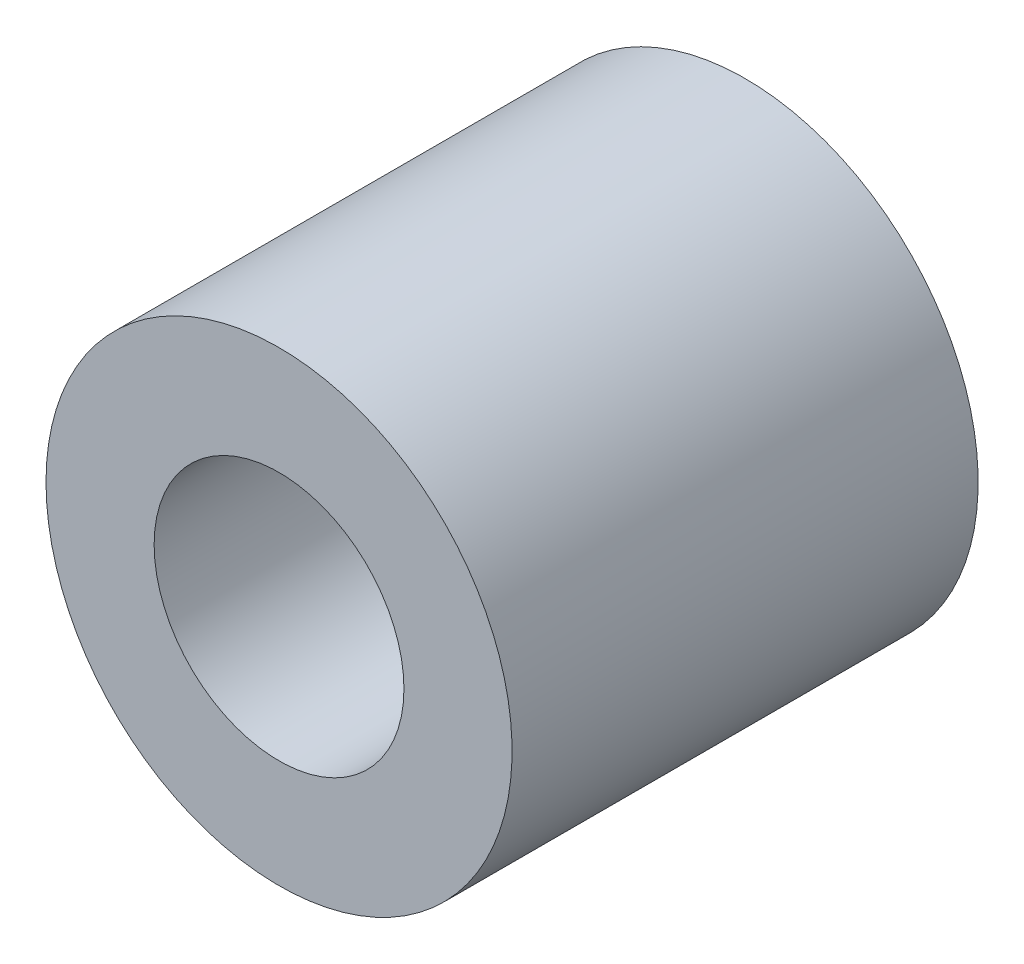
from build123d import *

# Parameters (mm, degrees)
SKETCH1_R           = 4.7625
SKETCH1_R_2         = 2.5527
BOSS_EXTRUDE1_DEPTH = 4.7625


with BuildPart() as part:
    # Sketch1 → Boss-Extrude1 (new, symmetric)
    with BuildSketch(Plane.XY):
        Circle(SKETCH1_R)
        Circle(SKETCH1_R_2, mode=Mode.SUBTRACT)
    extrude(amount=BOSS_EXTRUDE1_DEPTH, both=True)


solid = part.part
